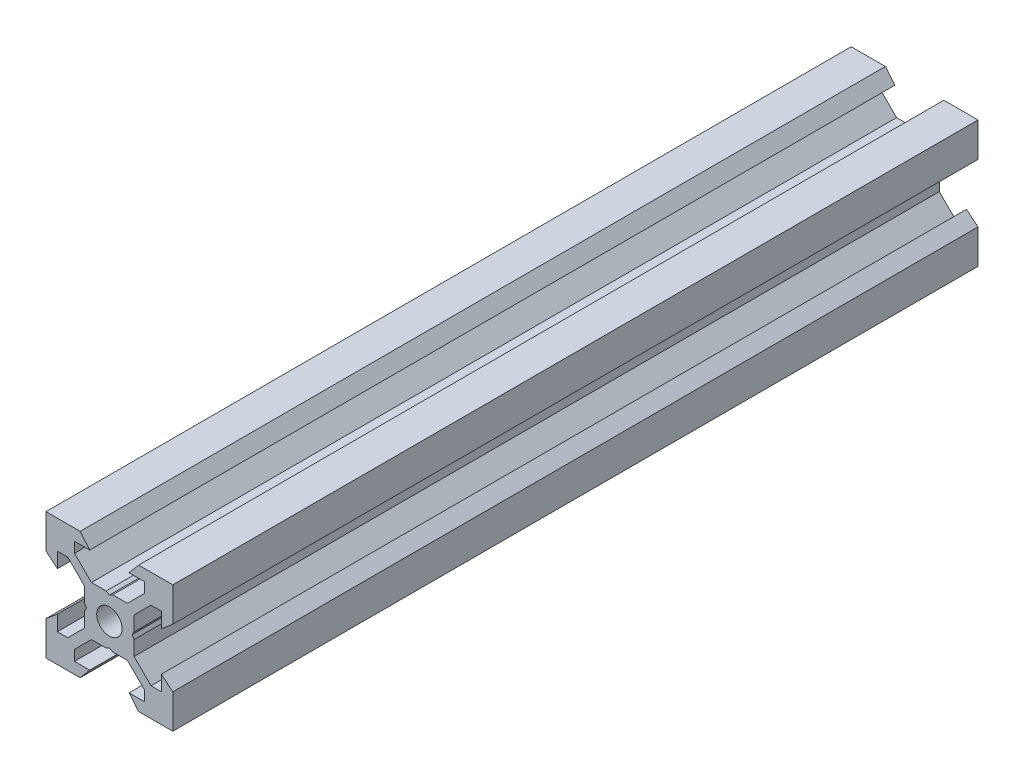
from build123d import *

# Parameters (mm, degrees)
SKETCH1_R           = 2
BOSS_EXTRUDE1_DEPTH = 63.5


with BuildPart() as part:
    # Sketch1 → Boss-Extrude1 (new, symmetric)
    with BuildSketch(Plane.XY):
        Polygon((10, 4.610379336), (10, 10), (4.610379336, 10), (3.1, 8.2), (5.5, 8.2), (5.5, 6.560660172), (2.839339828, 3.9), (0.519615242, 3.9), (0, 3.6), (-0.519615242, 3.9), (-2.839339828, 3.9), (-5.5, 6.560660172), (-5.5, 8.2), (-3.1, 8.2), (-4.610379336, 10), (-10, 10), (-10, 4.610379336), (-8.2, 3.1), (-8.2, 5.5), (-6.560660172, 5.5), (-3.9, 2.839339828), (-3.9, 0.519615242), (-3.6, 0), (-3.9, -0.519615242), (-3.9, -2.839339828), (-6.560660172, -5.5), (-8.2, -5.5), (-8.2, -3.1), (-10, -4.610379336), (-10, -10), (-4.610379336, -10), (-3.1, -8.2), (-5.5, -8.2), (-5.5, -6.560660172), (-2.839339828, -3.9), (-0.519615242, -3.9), (0, -3.6), (0.519615242, -3.9), (2.839339828, -3.9), (5.5, -6.560660172), (5.5, -8.2), (3.1, -8.2), (4.610379336, -10), (10, -10), (10, -4.610379336), (8.2, -3.1), (8.2, -5.5), (6.560660172, -5.5), (3.9, -2.839339828), (3.9, -0.519615242), (3.6, 0), (3.9, 0.519615242), (3.9, 2.839339828), (6.560660172, 5.5), (8.2, 5.5), (8.2, 3.1), align=None)
        Circle(SKETCH1_R, mode=Mode.SUBTRACT)
    extrude(amount=BOSS_EXTRUDE1_DEPTH, both=True)


solid = part.part
